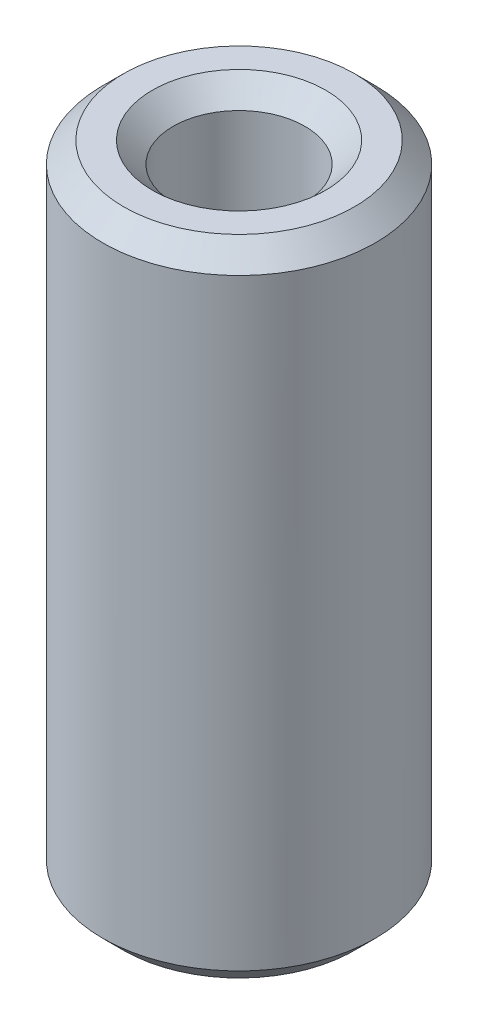
from build123d import *

# Parameters (mm, degrees)
SKETCH1_R           = 5
BOSS_EXTRUDE1_DEPTH = 23.628151187
SKETCH2_R           = 2.416875778
CUT_EXTRUDE1_DEPTH  = 25.663526279
CHAMFER1_SIZE       = 0.764984298


with BuildPart() as part:
    # Sketch1 → Boss-Extrude1 (new body)
    with BuildSketch(Plane(origin=(0, 0, 0), x_dir=(1, 0, 0), z_dir=(0, 1, 0))):
        Circle(SKETCH1_R)
    extrude(amount=BOSS_EXTRUDE1_DEPTH)

    # Sketch2 → Cut-Extrude1 (cut, through all)
    with BuildSketch(Plane(origin=(0, 0, 0), x_dir=(1, 0, 0), z_dir=(0, 1, 0))):
        Circle(SKETCH2_R)
    extrude(amount=CUT_EXTRUDE1_DEPTH, mode=Mode.SUBTRACT)

    # Chamfer1
    chamfer1_edges = [part.edges().sort_by_distance(p)[0] for p in [
        (-2.416875778, 23.628151187, 0),
        (-2.416875778, 0, 0),
        (-5, 0, 0),
        (-5, 23.628151187, 0),
    ]]
    chamfer(chamfer1_edges, length=CHAMFER1_SIZE)


solid = part.part
